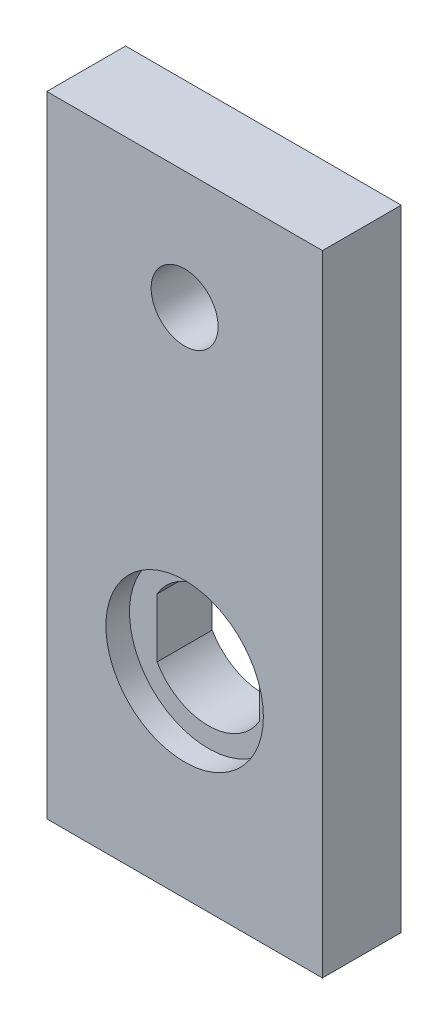
from build123d import *

# Parameters (mm, degrees)
FLANGE_BASE1_START             = -5
FLANGE_BASE1_OUTLINE_W         = 35
FLANGE_BASE1_OUTLINE_H         = 80
FLANGE_BASE1_DEPTH             = 10
FURO_ROSCADO_DE_M10X1_51_D     = 8.5
FURO_ROSCADO_DE_M10X1_51_DEPTH = 29.946342369
FURO_ROSCADO_DE_M10X1_51_TIP   = 2.553657631
ESBO_O9_R                      = 10
CORTE_EXTRUS_O2_DEPTH          = 3
CORTE_EXTRUS_O3_DEPTH          = 45.218208919


# Read off the part's stored shape, not the designer's step: Flange-base1
with BuildPart() as part:
    # Flange-base1 outline → Flange-base1 (new body)
    with BuildSketch(Plane.XY.offset(FLANGE_BASE1_START)):
        Rectangle(FLANGE_BASE1_OUTLINE_W, FLANGE_BASE1_OUTLINE_H)
    extrude(amount=FLANGE_BASE1_DEPTH)

    # Furo roscado de M10x1.51
    with Locations(Plane.XY.offset(5)):
        with Locations((0, 25)):
            Hole(FURO_ROSCADO_DE_M10X1_51_D / 2, depth=FURO_ROSCADO_DE_M10X1_51_DEPTH)
            with Locations((0, 0, -(FURO_ROSCADO_DE_M10X1_51_DEPTH + FURO_ROSCADO_DE_M10X1_51_TIP / 2))):  # 118° drill point
                Cone(0, FURO_ROSCADO_DE_M10X1_51_D / 2, FURO_ROSCADO_DE_M10X1_51_TIP, mode=Mode.SUBTRACT)

    # Esboço9 → Corte-extrusão2 (cut)
    with BuildSketch(Plane.XY.offset(5)):
        with Locations((0, -15)):
            Circle(ESBO_O9_R)
    extrude(amount=-CORTE_EXTRUS_O2_DEPTH, mode=Mode.SUBTRACT)

    # Esboço10 → Corte-extrusão3 (cut, through all)
    with BuildSketch(Plane.XY.offset(2)):
        with BuildLine():
            Line((-6.5, -11.258342613), (-6.5, -18.741657387))
            ThreePointArc((-6.5, -18.741657387), (0, -22.5), (6.5, -18.741657387))
            Line((6.5, -18.741657387), (6.5, -11.258342613))
            ThreePointArc((6.5, -11.258342613), (0, -7.5), (-6.5, -11.258342613))
        make_face()
    extrude(amount=-CORTE_EXTRUS_O3_DEPTH, mode=Mode.SUBTRACT)


solid = part.part
